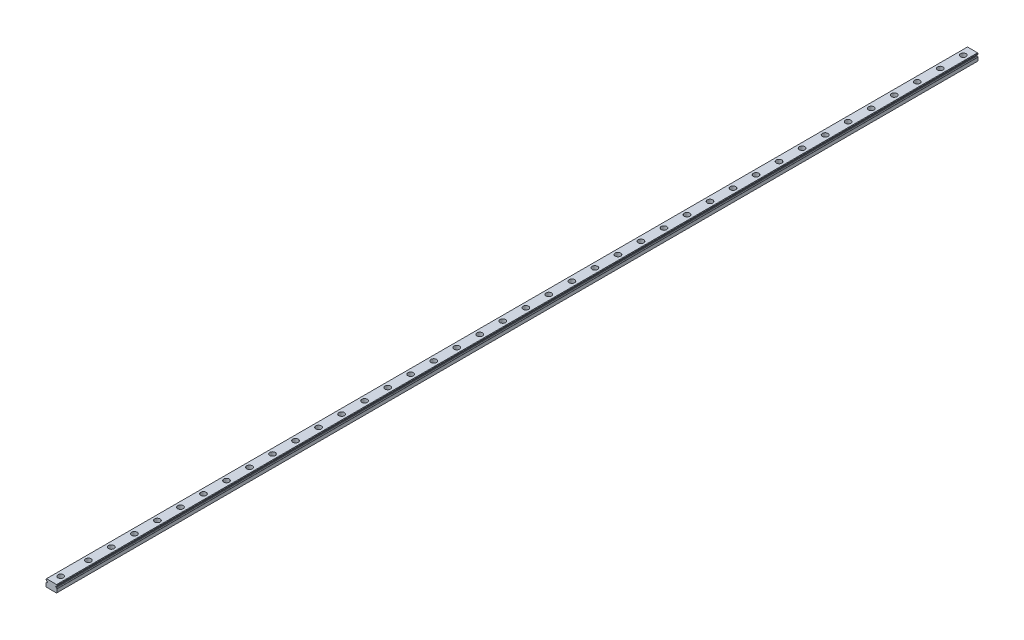
from build123d import *

# Parameters (mm, degrees)
RAIL_PROFILE_DEPTH             = 500
CBORE_FOR_M3_SHCS1_D           = 3.5
CBORE_FOR_M3_SHCS1_CBORE_D     = 6
CBORE_FOR_M3_SHCS1_CBORE_DEPTH = 4.5
FILL_START                     = -2.000000001
FILL_PATTERN1_OUTLINE_R        = 3
FILL_PATTERN1_DEPTH            = 4.5
FILL_START_2                   = -5.5
FILL_PATTERN1_2_OUTLINE_R      = 1.75
FILL_PATTERN1_2_DEPTH          = 3.499999999


# Read off the part's stored shape, not the designer's step: Fill Pattern1
with BuildPart() as part:
    # Sketch1 → RAIL PROFILE (new, symmetric)
    with BuildSketch(Plane.XY):
        with BuildLine():
            Line((-5.982334879, -1.370069213), (-5.982334879, -5.001472146))
            Line((-5.982334879, -5.001472146), (-5.483807025, -5.499999999))
            Line((-5.483807025, -5.499999999), (1.595289228, -5.499999999))
            ThreePointArc((1.595289228, -5.499999999), (1.994111552, -5.300588838), (2.392933875, -5.5))
            Line((2.392933875, -5.5), (5.483807024, -5.5))
            Line((5.483807024, -5.5), (5.982334878, -5.001472147))
            Line((5.982334878, -5.001472147), (5.982334878, -1.370069213))
            ThreePointArc((5.982334878, -1.370069213), (5.940056641, -1.231182813), (5.82756375, -1.139410101))
            ThreePointArc((5.82756375, -1.139410101), (5.497041405, -0.930122348), (5.251697363, -0.625405104))
            ThreePointArc((5.251697363, -0.625405104), (5.169975597, -0.541388466), (5.058890009, -0.504008866))
            Line((5.058890009, -0.504008866), (4.71429032, -0.473860299))
            ThreePointArc((4.71429032, -0.473860299), (4.552238438, -0.393945155), (4.486751147, -0.225544865))
            Line((4.486751147, -0.225544865), (4.486751147, 0.225544865))
            ThreePointArc((4.486751147, 0.225544865), (4.552238438, 0.393945155), (4.71429032, 0.473860299))
            Line((4.71429032, 0.473860299), (5.079776582, 0.505836204))
            ThreePointArc((5.079776582, 0.505836204), (5.187925163, 0.5413949), (5.268982803, 0.621333598))
            ThreePointArc((5.268982803, 0.621333598), (5.511607978, 0.899707672), (5.82756375, 1.09083865))
            ThreePointArc((5.82756375, 1.09083865), (5.940040963, 1.182638806), (5.982312115, 1.321532803))
            Line((5.982312115, 1.321532803), (5.982321902, 2.00145917))
            Line((5.982321902, 2.00145917), (5.483807025, 2.499999999))
            Line((5.483807025, 2.499999999), (-5.483807026, 2.499999999))
            Line((-5.483807026, 2.499999999), (-5.982321903, 2.00145917))
            Line((-5.982321903, 2.00145917), (-5.982321903, 1.32884687))
            ThreePointArc((-5.982321903, 1.32884687), (-5.942177076, 1.185718341), (-5.827697321, 1.090893402))
            ThreePointArc((-5.827697321, 1.090893402), (-5.511663234, 0.899754111), (-5.268982805, 0.621333597))
            ThreePointArc((-5.268982805, 0.621333597), (-5.187925164, 0.541394898), (-5.079776582, 0.505836204))
            Line((-5.079776582, 0.505836204), (-4.71429032, 0.473860299))
            ThreePointArc((-4.71429032, 0.473860299), (-4.552238438, 0.393945155), (-4.486751147, 0.225544865))
            Line((-4.486751147, 0.225544865), (-4.486751147, -0.225544865))
            ThreePointArc((-4.486751147, -0.225544865), (-4.552238438, -0.393945155), (-4.71429032, -0.473860299))
            Line((-4.71429032, -0.473860299), (-5.058890009, -0.504008866))
            ThreePointArc((-5.058890009, -0.504008866), (-5.169975597, -0.541388466), (-5.251697363, -0.625405104))
            ThreePointArc((-5.251697363, -0.625405104), (-5.499180752, -0.921502608), (-5.828043428, -1.123421157))
            ThreePointArc((-5.828043428, -1.123421157), (-5.944906256, -1.221900029), (-5.982334879, -1.370069213))
        make_face()
    extrude(amount=RAIL_PROFILE_DEPTH, both=True)

    # CBORE for M3 SHCS1 (through all)
    with Locations(Plane(origin=(0, 2.499999999, 0), x_dir=(1, 0, 0), z_dir=(0, 1, 0))):
        with Locations((0, 490)):
            cbore_for_m3_shcs1 = CounterBoreHole(CBORE_FOR_M3_SHCS1_D / 2, CBORE_FOR_M3_SHCS1_CBORE_D / 2, CBORE_FOR_M3_SHCS1_CBORE_DEPTH)

    # M3 END MIRROR: CBORE for M3 SHCS1 across plane
    add(cbore_for_m3_shcs1.mirror(Plane.XY), mode=Mode.SUBTRACT)

    # Fill Pattern1 outline → Fill Pattern1 (cut)
    with BuildSketch(Plane(origin=(0, 0, 0), x_dir=(1, 0, 0), z_dir=(0, 1, 0)).offset(FILL_START)):
        with Locations((0, 465)):
            Circle(FILL_PATTERN1_OUTLINE_R)
        with Locations((0, 440)):
            Circle(FILL_PATTERN1_OUTLINE_R)
        with Locations((0, 415)):
            Circle(FILL_PATTERN1_OUTLINE_R)
        with Locations((0, 390)):
            Circle(FILL_PATTERN1_OUTLINE_R)
        with Locations((0, 365)):
            Circle(FILL_PATTERN1_OUTLINE_R)
        with Locations((0, 340)):
            Circle(FILL_PATTERN1_OUTLINE_R)
        with Locations((0, 315)):
            Circle(FILL_PATTERN1_OUTLINE_R)
        with Locations((0, 290)):
            Circle(FILL_PATTERN1_OUTLINE_R)
        with Locations((0, 265)):
            Circle(FILL_PATTERN1_OUTLINE_R)
        with Locations((0, 240)):
            Circle(FILL_PATTERN1_OUTLINE_R)
        with Locations((0, 215)):
            Circle(FILL_PATTERN1_OUTLINE_R)
        with Locations((0, 190)):
            Circle(FILL_PATTERN1_OUTLINE_R)
        with Locations((0, 165)):
            Circle(FILL_PATTERN1_OUTLINE_R)
        with Locations((0, 140)):
            Circle(FILL_PATTERN1_OUTLINE_R)
        with Locations((0, 115)):
            Circle(FILL_PATTERN1_OUTLINE_R)
        with Locations((0, 90)):
            Circle(FILL_PATTERN1_OUTLINE_R)
        with Locations((0, 65)):
            Circle(FILL_PATTERN1_OUTLINE_R)
        with Locations((0, 40)):
            Circle(FILL_PATTERN1_OUTLINE_R)
        with Locations((0, 15)):
            Circle(FILL_PATTERN1_OUTLINE_R)
        with Locations((0, -10)):
            Circle(FILL_PATTERN1_OUTLINE_R)
        with Locations((0, -35)):
            Circle(FILL_PATTERN1_OUTLINE_R)
        with Locations((0, -60)):
            Circle(FILL_PATTERN1_OUTLINE_R)
        with Locations((0, -85)):
            Circle(FILL_PATTERN1_OUTLINE_R)
        with Locations((0, -110)):
            Circle(FILL_PATTERN1_OUTLINE_R)
        with Locations((0, -135)):
            Circle(FILL_PATTERN1_OUTLINE_R)
        with Locations((0, -160)):
            Circle(FILL_PATTERN1_OUTLINE_R)
        with Locations((0, -185)):
            Circle(FILL_PATTERN1_OUTLINE_R)
        with Locations((0, -210)):
            Circle(FILL_PATTERN1_OUTLINE_R)
        with Locations((0, -235)):
            Circle(FILL_PATTERN1_OUTLINE_R)
        with Locations((0, -260)):
            Circle(FILL_PATTERN1_OUTLINE_R)
        with Locations((0, -285)):
            Circle(FILL_PATTERN1_OUTLINE_R)
        with Locations((0, -310)):
            Circle(FILL_PATTERN1_OUTLINE_R)
        with Locations((0, -335)):
            Circle(FILL_PATTERN1_OUTLINE_R)
        with Locations((0, -360)):
            Circle(FILL_PATTERN1_OUTLINE_R)
        with Locations((0, -385)):
            Circle(FILL_PATTERN1_OUTLINE_R)
        with Locations((0, -410)):
            Circle(FILL_PATTERN1_OUTLINE_R)
        with Locations((0, -435)):
            Circle(FILL_PATTERN1_OUTLINE_R)
        with Locations((0, -460)):
            Circle(FILL_PATTERN1_OUTLINE_R)
    extrude(amount=FILL_PATTERN1_DEPTH, mode=Mode.SUBTRACT)

    # Fill Pattern1 2 outline → Fill Pattern1 2 (cut)
    with BuildSketch(Plane(origin=(0, 0, 0), x_dir=(1, 0, 0), z_dir=(0, 1, 0)).offset(FILL_START_2)):
        with Locations((0, 465)):
            Circle(FILL_PATTERN1_2_OUTLINE_R)
        with Locations((0, 440)):
            Circle(FILL_PATTERN1_2_OUTLINE_R)
        with Locations((0, 415)):
            Circle(FILL_PATTERN1_2_OUTLINE_R)
        with Locations((0, 390)):
            Circle(FILL_PATTERN1_2_OUTLINE_R)
        with Locations((0, 365)):
            Circle(FILL_PATTERN1_2_OUTLINE_R)
        with Locations((0, 340)):
            Circle(FILL_PATTERN1_2_OUTLINE_R)
        with Locations((0, 315)):
            Circle(FILL_PATTERN1_2_OUTLINE_R)
        with Locations((0, 290)):
            Circle(FILL_PATTERN1_2_OUTLINE_R)
        with Locations((0, 265)):
            Circle(FILL_PATTERN1_2_OUTLINE_R)
        with Locations((0, 240)):
            Circle(FILL_PATTERN1_2_OUTLINE_R)
        with Locations((0, 215)):
            Circle(FILL_PATTERN1_2_OUTLINE_R)
        with Locations((0, 190)):
            Circle(FILL_PATTERN1_2_OUTLINE_R)
        with Locations((0, 165)):
            Circle(FILL_PATTERN1_2_OUTLINE_R)
        with Locations((0, 140)):
            Circle(FILL_PATTERN1_2_OUTLINE_R)
        with Locations((0, 115)):
            Circle(FILL_PATTERN1_2_OUTLINE_R)
        with Locations((0, 90)):
            Circle(FILL_PATTERN1_2_OUTLINE_R)
        with Locations((0, 65)):
            Circle(FILL_PATTERN1_2_OUTLINE_R)
        with Locations((0, 40)):
            Circle(FILL_PATTERN1_2_OUTLINE_R)
        with Locations((0, 15)):
            Circle(FILL_PATTERN1_2_OUTLINE_R)
        with Locations((0, -10)):
            Circle(FILL_PATTERN1_2_OUTLINE_R)
        with Locations((0, -35)):
            Circle(FILL_PATTERN1_2_OUTLINE_R)
        with Locations((0, -60)):
            Circle(FILL_PATTERN1_2_OUTLINE_R)
        with Locations((0, -85)):
            Circle(FILL_PATTERN1_2_OUTLINE_R)
        with Locations((0, -110)):
            Circle(FILL_PATTERN1_2_OUTLINE_R)
        with Locations((0, -135)):
            Circle(FILL_PATTERN1_2_OUTLINE_R)
        with Locations((0, -160)):
            Circle(FILL_PATTERN1_2_OUTLINE_R)
        with Locations((0, -185)):
            Circle(FILL_PATTERN1_2_OUTLINE_R)
        with Locations((0, -210)):
            Circle(FILL_PATTERN1_2_OUTLINE_R)
        with Locations((0, -235)):
            Circle(FILL_PATTERN1_2_OUTLINE_R)
        with Locations((0, -260)):
            Circle(FILL_PATTERN1_2_OUTLINE_R)
        with Locations((0, -285)):
            Circle(FILL_PATTERN1_2_OUTLINE_R)
        with Locations((0, -310)):
            Circle(FILL_PATTERN1_2_OUTLINE_R)
        with Locations((0, -335)):
            Circle(FILL_PATTERN1_2_OUTLINE_R)
        with Locations((0, -360)):
            Circle(FILL_PATTERN1_2_OUTLINE_R)
        with Locations((0, -385)):
            Circle(FILL_PATTERN1_2_OUTLINE_R)
        with Locations((0, -410)):
            Circle(FILL_PATTERN1_2_OUTLINE_R)
        with Locations((0, -435)):
            Circle(FILL_PATTERN1_2_OUTLINE_R)
        with Locations((0, -460)):
            Circle(FILL_PATTERN1_2_OUTLINE_R)
    extrude(amount=FILL_PATTERN1_2_DEPTH, mode=Mode.SUBTRACT)


solid = part.part
